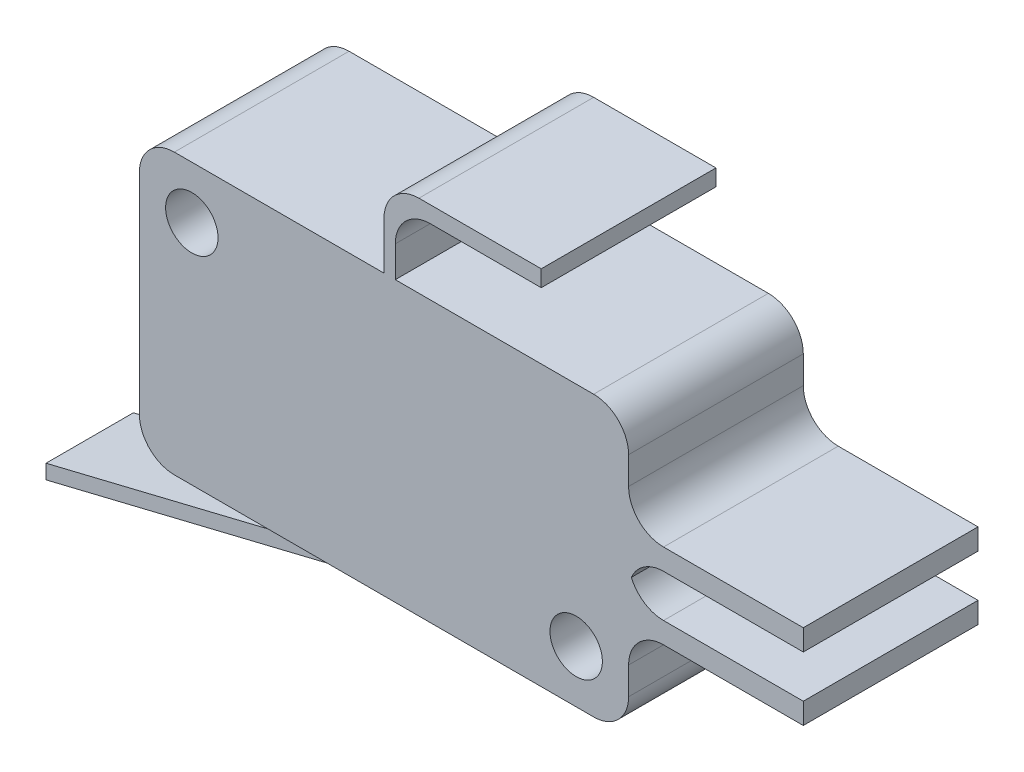
from build123d import *

# Parameters (mm, degrees)
SKETCH2_R           = 1.5
BOSS_EXTRUDE1_DEPTH = 10
FILLET1_R           = 2
BOSS_EXTRUDE2_DEPTH = 2.5
FILLET2_R           = 2


with BuildPart() as part:
    # Sketch2 → Boss-Extrude1 (new body)
    with BuildSketch(Plane.XY):
        Polygon((0, 8), (0, 12.716374873), (9, 12.716374873), (9, 11.778068475), (0.647378108, 11.778068475), (0.647378108, 8), (14, 8), (14, 2.424084127), (24, 2.424084127), (24, 1.218725863), (14, 1.218725863), (14, -1.218725863), (24, -1.218725863), (24, -2.424084127), (14, -2.424084127), (14, -8), (3.483162405, -8), (-14, -8), (-14, 8), align=None)
        with Locations((-11, 5)):
            Circle(SKETCH2_R, mode=Mode.SUBTRACT)
        with Locations((11, -5)):
            Circle(SKETCH2_R, mode=Mode.SUBTRACT)
    extrude(amount=BOSS_EXTRUDE1_DEPTH)

    # Fillet1
    # the kernel refuses this fillet: 2 mm, written as the material it adds along each edge
    with BuildSketch(Plane(origin=(0.647378108, 11.778068475, 0), x_dir=(0, -1, 0), z_dir=(0, 0, 1)), Plane(origin=(14, 2.424084127, 0), x_dir=(1, 0, 0), z_dir=(0, 0, 1)), Plane(origin=(14, 1.218725863, 0), x_dir=(0, -1, 0), z_dir=(0, 0, 1)), Plane(origin=(14, -1.218725863, 0), x_dir=(1, 0, 0), z_dir=(0, 0, 1)), Plane(origin=(14, -2.424084127, 0), x_dir=(0, -1, 0), z_dir=(0, 0, 1))) as fillet1_piece_1:
        with BuildLine():
            CenterArc((FILLET1_R, FILLET1_R), FILLET1_R, 180, 90)
            Line((0, FILLET1_R), (0, 0))
            Line((0, 0), (FILLET1_R, 0))
        make_face()
    extrude(amount=10)
    # the kernel refuses this fillet: 2 mm, written as the material it takes off along each edge
    with BuildSketch(Plane(origin=(0, 12.716374873, -5), x_dir=(0, -1, 0), z_dir=(0, 0, 1)), Plane(origin=(14, 8, -5), x_dir=(-1, 0, 0), z_dir=(0, 0, 1)), Plane(origin=(14, -8, -5), x_dir=(0, 1, 0), z_dir=(0, 0, 1))) as fillet1_2_piece_1:
        with BuildLine():
            CenterArc((FILLET1_R, FILLET1_R), FILLET1_R, 180, 90)
            Line((0, FILLET1_R), (0, 0))
            Line((0, 0), (FILLET1_R, 0))
        make_face()
    extrude(amount=20, mode=Mode.SUBTRACT)
    with BuildSketch(Plane(origin=(-14, -8, -5), x_dir=(0, 1, 0), z_dir=(0, 0, 1)), Plane(origin=(-14, 8, -5), x_dir=(1, 0, 0), z_dir=(0, 0, 1))) as fillet1_2_piece_2:
        with BuildLine():
            CenterArc((FILLET1_R, -FILLET1_R), FILLET1_R, 90, 90)
            Line((0, -FILLET1_R), (0, 0))
            Line((0, 0), (FILLET1_R, 0))
        make_face()
    extrude(amount=20, mode=Mode.SUBTRACT)


with BuildPart() as body_2:
    # Sketch3 → Boss-Extrude2 (new, symmetric)
    with BuildSketch(Plane(origin=(0, 0, 5), x_dir=(-1, 0, 0), z_dir=(0, 0, -1))):
        Polygon((-1.109166196, -8), (-1.109166196, -8.82795975), (21.846753247, -14.421033343), (21.846753247, -13.594231159), align=None)
    extrude(amount=BOSS_EXTRUDE2_DEPTH, both=True)

    # Fillet2
    # the kernel refuses this fillet: 2 mm, written as the material it takes off along each edge
    with BuildSketch(Plane(origin=(1.109166196, -8.82795975, 11.018292786), x_dir=(0, 1, 0), z_dir=(0, 0, -1))) as fillet2_piece_1:
        with BuildLine():
            CenterArc((1.610017159, -1.840756966), FILLET2_R, 113.018523563, 53.28848865)
            Line((-0.333139038, -1.367318486), (-0.372002162, -1.357849716))
            Line((-0.372002162, -1.357849716), (-0.038863124, 0.00946877))
            Line((-0.038863124, 0.00946877), (0, 0.04))
            ThreePointArc((0, 0.04), (0.413979875, 0.04), (0.812318601, 0.036815139))
            Line((0.812318601, 0.036815139), (0.82795975, 0))
        make_face()
    extrude(amount=12.036585572, mode=Mode.SUBTRACT)


solid = Compound([part.part, body_2.part])
